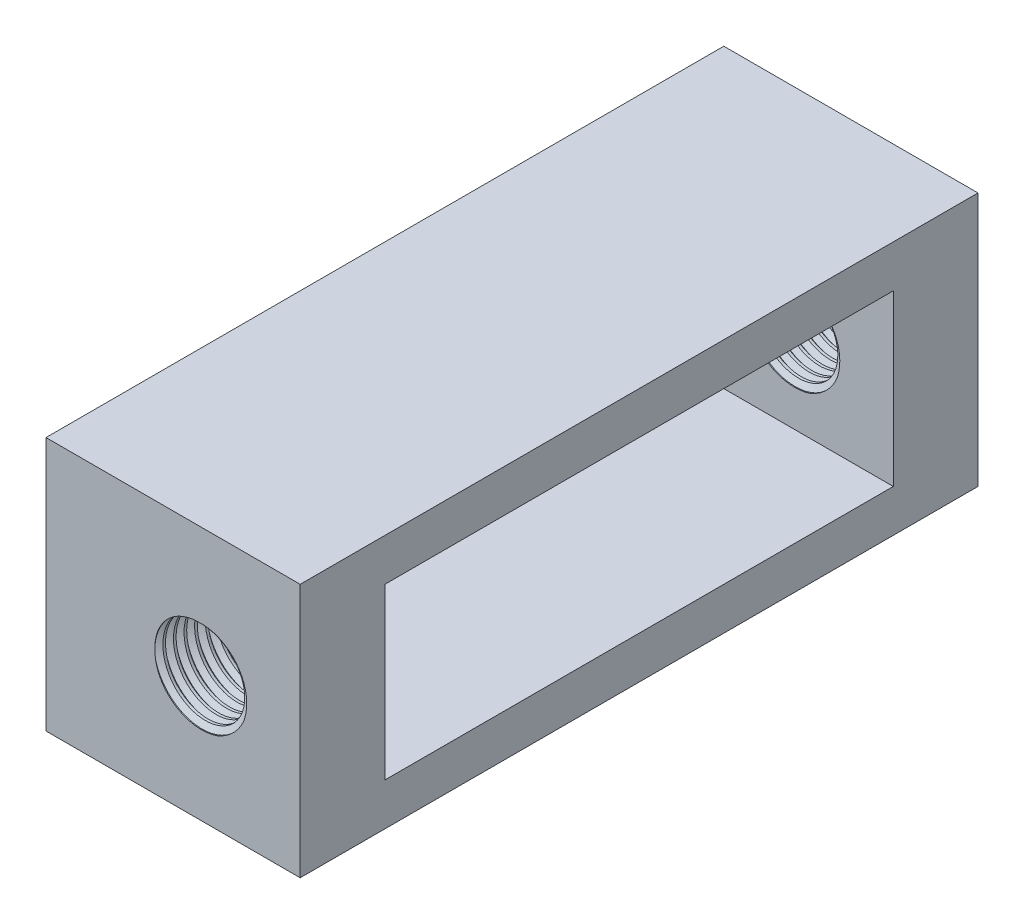
from build123d import *

# Parameters (mm, degrees)
SKETCH1_W           = 76.2
SKETCH1_H           = 76.2
BOSS_EXTRUDE1_DEPTH = 203.2
SKETCH5_W           = 152.4
SKETCH5_H           = 50.8
CUT_EXTRUDE2_DEPTH  = 50.8
SKETCH6_R           = 13.057901263
CUT_EXTRUDE3_DEPTH  = 211.222406037
THREAD1_PITCH       = 3.175
THREAD2_PITCH       = 3.175


with BuildPart() as part:
    # Sketch1 → Boss-Extrude1 (new body)
    with BuildSketch(Plane.XY):
        Rectangle(SKETCH1_W, SKETCH1_H)
    extrude(amount=BOSS_EXTRUDE1_DEPTH)

    # Sketch5 → Cut-Extrude2 (cut)
    with BuildSketch(Plane(origin=(38.1, 0, 0), x_dir=(0, 0, -1), z_dir=(1, 0, 0))):
        with Locations((-101.6, 0)):
            Rectangle(SKETCH5_W, SKETCH5_H)
    extrude(amount=-CUT_EXTRUDE2_DEPTH, mode=Mode.SUBTRACT)

    # Sketch6 → Cut-Extrude3 (cut, through all)
    with BuildSketch(Plane(origin=(0, 0, 0), x_dir=(-1, 0, 0), z_dir=(0, 0, -1))):
        with Locations((-7.62, 0)):
            Circle(SKETCH6_R)
    extrude(amount=-CUT_EXTRUDE3_DEPTH, mode=Mode.SUBTRACT)

    # Thread1: arcs per turn and ends read off the stored shape
    # Thread1: the profile of Thread Profile1 profile screwed along a right-hand helix through 80 turns, 6 arcs to a turn; built about Z, then put on its axis
    thread1_z = Axis((0, 0, 0), (0, 0, 1))
    thread1_corners = [(13.057601263, 0, -0.000173205), (14.776420416, 0, 0.992187496), (14.776420416, 0, 1.389062496), (13.057601263, 0, 2.381423196)]
    with BuildLine(mode=Mode.PRIVATE) as thread1_profile:
        Line(thread1_corners[0], thread1_corners[1])
        Line(thread1_corners[1], thread1_corners[2])
        Line(thread1_corners[2], thread1_corners[3])
        Line(thread1_corners[3], thread1_corners[0])
    thread1_cap = Face(thread1_profile.wire())
    thread1_turn_angles = [0, 30, 60, 90, 120, 150, 180, 210, 240, 270, 300, 330, 360]
    thread1_turn_weights = [1, 0.8660254037844387, 1, 0.8660254037844387, 1, 0.8660254037844387, 1, 0.8660254037844387, 1, 0.8660254037844387, 1, 0.8660254037844387, 1]
    thread1_turn_rails = [Edge.make_bspline([Vector(p[0], p[1], 0).rotate(thread1_z, thread1_turn_angles[k]) / thread1_turn_weights[k] + Vector(0, 0, p[2] + THREAD1_PITCH * thread1_turn_angles[k] / 360) for k in range(13)], [0, 0, 0, 1, 1, 2, 2, 3, 3, 4, 4, 5, 5, 6, 6, 6], 2, thread1_turn_weights) for p in thread1_corners]
    thread1_turn_sides = [Face.make_surface_from_curves(thread1_turn_rails[p[0]], thread1_turn_rails[p[1]]) for p in [(0, 1), (1, 2), (2, 3), (3, 0)]]
    thread1 = Plane(origin=(7.62, 0, 177.8), x_dir=(-1, 0, 0), z_dir=(0, 0, -1)) * Solid(Shell([*[p.moved(Location((0, 0, THREAD1_PITCH * i))) for i in range(80) for p in thread1_turn_sides], thread1_cap, thread1_cap.rotate(thread1_z, 28800).moved(Location((0, 0, THREAD1_PITCH * 28800 / 360)))]))
    add(thread1, mode=Mode.SUBTRACT)

    # Thread2: arcs per turn and ends read off the stored shape
    # Thread2: the profile of Thread Profile2 profile screwed along a right-hand helix through 80 turns, 6 arcs to a turn; built about Z, then put on its axis
    thread2_z = Axis((0, 0, 0), (0, 0, 1))
    thread2_corners = [(13.057601263, 0, -254.000173205), (14.776420416, 0, -253.007812504), (14.776420416, 0, -252.610937504), (13.057601263, 0, -251.618576804)]
    with BuildLine(mode=Mode.PRIVATE) as thread2_profile:
        Line(thread2_corners[0], thread2_corners[1])
        Line(thread2_corners[1], thread2_corners[2])
        Line(thread2_corners[2], thread2_corners[3])
        Line(thread2_corners[3], thread2_corners[0])
    thread2_cap = Face(thread2_profile.wire())
    thread2_turn_angles = [0, 30, 60, 90, 120, 150, 180, 210, 240, 270, 300, 330, 360]
    thread2_turn_weights = [1, 0.8660254037844387, 1, 0.8660254037844387, 1, 0.8660254037844387, 1, 0.8660254037844387, 1, 0.8660254037844387, 1, 0.8660254037844387, 1]
    thread2_turn_rails = [Edge.make_bspline([Vector(p[0], p[1], 0).rotate(thread2_z, thread2_turn_angles[k]) / thread2_turn_weights[k] + Vector(0, 0, p[2] + THREAD2_PITCH * thread2_turn_angles[k] / 360) for k in range(13)], [0, 0, 0, 1, 1, 2, 2, 3, 3, 4, 4, 5, 5, 6, 6, 6], 2, thread2_turn_weights) for p in thread2_corners]
    thread2_turn_sides = [Face.make_surface_from_curves(thread2_turn_rails[p[0]], thread2_turn_rails[p[1]]) for p in [(0, 1), (1, 2), (2, 3), (3, 0)]]
    thread2 = Plane(origin=(7.62, 0, 25.4), x_dir=(-1, 0, 0), z_dir=(0, 0, -1)) * Solid(Shell([*[p.moved(Location((0, 0, THREAD2_PITCH * i))) for i in range(80) for p in thread2_turn_sides], thread2_cap, thread2_cap.rotate(thread2_z, 28800).moved(Location((0, 0, THREAD2_PITCH * 28800 / 360)))]))
    add(thread2, mode=Mode.SUBTRACT)


solid = part.part
